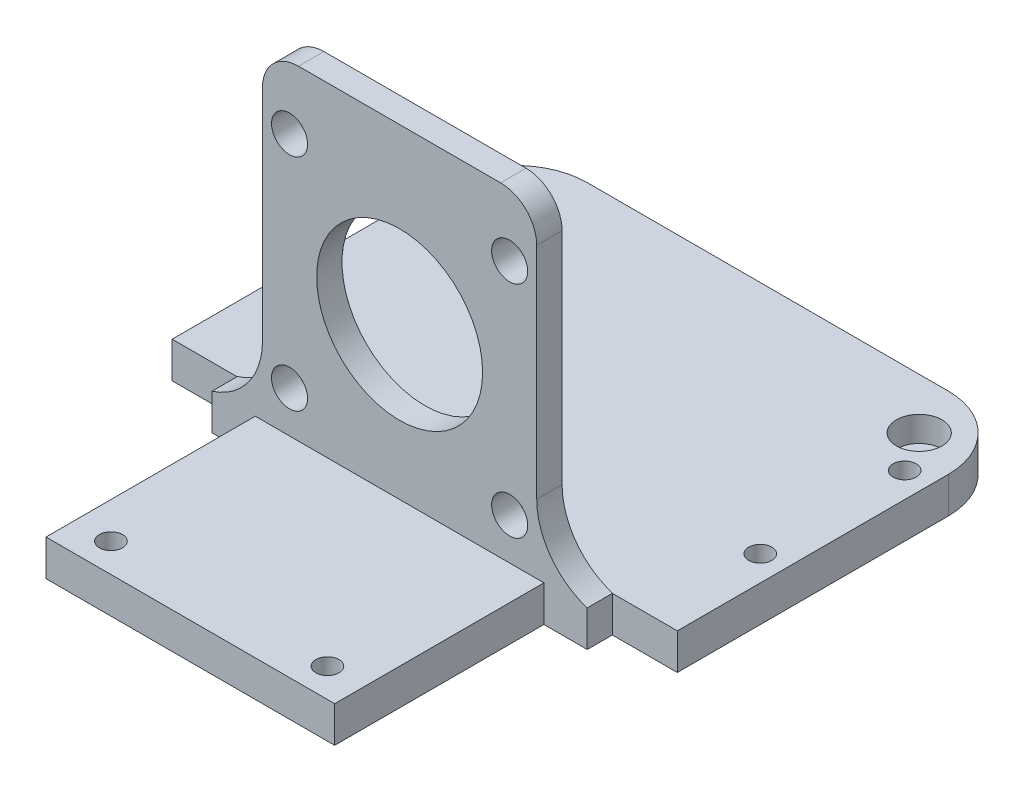
from build123d import *

# Parameters (mm, degrees)
SKETCH_1_W           = 70
SKETCH_1_H           = 5
EXTRUDE_1_DEPTH      = 8
SKETCH_3_W           = 38
SKETCH_3_H           = 5
EXTRUDE_2_DEPTH      = 43
SKETCH_4_W           = 38
SKETCH_4_H           = 5
EXTRUDE_3_DEPTH      = 45
SKETCH_5_R           = 11.5
SKETCH_5_R_2         = 1.6
CUT_EXTRUDE_2_DEPTH  = 45
FILLET_1_R           = 5
CUT_EXTRUDE_3_REACH  = 81.536
SKETCH_6_W           = 42
SKETCH_6_H           = 1.562526182
EXTRUDE_4_DEPTH      = 7
EXTRUDE_4_DEPTH_BACK = 45
SKETCH_7_W           = 13.004753842
SKETCH_7_H           = 5
FILLET_2_R           = 10
SKETCH_13_W          = 70
SKETCH_13_H          = 47.548344346
EXTRUDE_6_DEPTH      = 5
SKETCH_10_R          = 2.5
CUT_EXTRUDE_6_DEPTH  = 10
SKETCH_11_W          = 40
SKETCH_11_H          = 5
EXTRUDE_5_DEPTH      = 29
SKETCH_12_R          = 1.6
CUT_EXTRUDE_7_DEPTH  = 7
SKETCH_14_R          = 1.6
CUT_EXTRUDE_8_DEPTH  = 7
SKETCH_15_R          = 3.15
CUT_EXTRUDE_9_DEPTH  = 3.5
FILLET_3_R           = 10
SKETCH_16_R          = 1.6
CUT_EXTRUDE_10_DEPTH = 10


with BuildPart() as part:
    # 草图1 → 凸台-拉伸1 (new body)
    with BuildSketch(Plane.XY):
        Rectangle(SKETCH_1_W, SKETCH_1_H)
    extrude(amount=EXTRUDE_1_DEPTH)

    # 草图3 → 凸台-拉伸2 (add)
    with BuildSketch(Plane.XY.offset(8)):
        Rectangle(SKETCH_3_W, SKETCH_3_H)
    extrude(amount=EXTRUDE_2_DEPTH)

    # 草图4 → 凸台-拉伸3 (add)
    with BuildSketch(Plane(origin=(0, 2.5, 0), x_dir=(1, 0, 0), z_dir=(0, 1, 0))):
        with Locations((0, -48.5)):
            Rectangle(SKETCH_4_W, SKETCH_4_H)
    extrude(amount=EXTRUDE_3_DEPTH)

    # 草图5 → 切除-拉伸2 (cut)
    with BuildSketch(Plane.XY.offset(51)):
        with Locations((0, 23.5)):
            Circle(SKETCH_5_R)
        with Locations((-15.25, 38.75)):
            Circle(SKETCH_5_R_2)
        with Locations((15.25, 38.75)):
            Circle(SKETCH_5_R_2)
        with Locations((-15.25, 8.25)):
            Circle(SKETCH_5_R_2)
        with Locations((15.25, 8.25)):
            Circle(SKETCH_5_R_2)
    extrude(amount=-CUT_EXTRUDE_2_DEPTH, mode=Mode.SUBTRACT)

    # 圆角1
    fillet_1_edges = [part.edges().sort_by_distance(p)[0] for p in [
        (-19, 47.5, 48.5),
        (19, 47.5, 48.5),
    ]]
    fillet(fillet_1_edges, radius=FILLET_1_R)

    # 切除-拉伸3: up to this face of the body (flat: up to its plane)
    cut_extrude_3_end = Plane(part.part.faces().sort_by_distance((0, 2.5, 20.572854291))[0])
    # 草图6 → 切除-拉伸3 (cut, up to the picked face)
    with BuildSketch(Plane(origin=(0, 47.5, 0), x_dir=(1, 0, 0), z_dir=(0, 1, 0)), mode=Mode.PRIVATE) as cut_extrude_3_sk1:
        with Locations((0, -46.703490751)):
            Rectangle(SKETCH_6_W, SKETCH_6_H)
    cut_extrude_3_tool1 = split(extrude(cut_extrude_3_sk1.sketch, amount=-CUT_EXTRUDE_3_REACH, mode=Mode.PRIVATE), bisect_by=cut_extrude_3_end, keep=Keep.BOTH, mode=Mode.PRIVATE)
    add(cut_extrude_3_tool1.solids().sort_by(Axis((0, 47.5, 46.703491), (0, -1, 0)))[0], mode=Mode.SUBTRACT)

    # 草图7 → 凸台-拉伸4 (add, two sides: drawn at the far end of the back side and taken through both)
    with BuildSketch(Plane(origin=(19, 0, 0), x_dir=(0, 0, -1), z_dir=(1, 0, 0)).offset(-EXTRUDE_4_DEPTH_BACK)):
        with Locations((-44.497623079, 0)):
            Rectangle(SKETCH_7_W, SKETCH_7_H)
    extrude(amount=EXTRUDE_4_DEPTH + EXTRUDE_4_DEPTH_BACK)

    # 圆角2
    # the kernel refuses this fillet: 10 mm, written as the material it adds along each edge
    with BuildSketch(Plane(origin=(-19, 2.5, 47.484753842), x_dir=(-1, 0, 0), z_dir=(0, 0, 1)), Plane(origin=(19, 2.5, 51), x_dir=(1, 0, 0), z_dir=(0, 0, -1))) as fillet_2_piece_1:
        with BuildLine():
            CenterArc((10, -9.539392014), FILLET_2_R, 107.457603124, 72.542396876)
            Line((0, -9.539392014), (-0.2, -9.539392014))
            Line((-0.2, -9.539392014), (-0.2, 0))
            Line((-0.2, 0), (0, 0.2))
            ThreePointArc((0, 0.2), (3.5, 0.2), (6.94, 0.19078784))
            Line((6.94, 0.19078784), (7, 0))
        make_face()
    extrude(amount=3.515246158)

    # 草图13 → 凸台-拉伸6 (add)
    with BuildSketch(Plane(origin=(0, 2.5, 0), x_dir=(1, 0, 0), z_dir=(0, 1, 0))):
        with Locations((0, -23.742376921)):
            Rectangle(SKETCH_13_W, SKETCH_13_H)
    extrude(amount=-EXTRUDE_6_DEPTH)

    # 草图10 → 切除-拉伸6 (cut)
    with BuildSketch(Plane.XY.offset(51)):
        with Locations((-15.25, 38.75)):
            Circle(SKETCH_10_R)
        with Locations((15.25, 38.75)):
            Circle(SKETCH_10_R)
        with Locations((15.25, 8.25)):
            Circle(SKETCH_10_R)
        with Locations((-15.25, 8.25)):
            Circle(SKETCH_10_R)
    extrude(amount=-CUT_EXTRUDE_6_DEPTH, mode=Mode.SUBTRACT)

    # 草图11 → 凸台-拉伸5 (add)
    with BuildSketch(Plane.XY.offset(51)):
        Rectangle(SKETCH_11_W, SKETCH_11_H)
    extrude(amount=EXTRUDE_5_DEPTH)

    # 草图12 → 切除-拉伸7 (cut)
    with BuildSketch(Plane(origin=(0, 2.5, 0), x_dir=(1, 0, 0), z_dir=(0, 1, 0))):
        with Locations(Location((15, -76, 0), (0, 0, 180))):
            Circle(SKETCH_12_R)
        with Locations(Location((-15, -76, 0), (0, 0, 180))):
            Circle(SKETCH_12_R)
    extrude(amount=-CUT_EXTRUDE_7_DEPTH, mode=Mode.SUBTRACT)

    # 草图14 → 切除-拉伸8 (cut)
    with BuildSketch(Plane(origin=(0, 2.5, 0), x_dir=(1, 0, 0), z_dir=(0, 1, 0))):
        with Locations(Location((28, -7, 0), (0, 0, 270))):
            Circle(SKETCH_14_R)
        with Locations(Location((-28, -7, 0), (0, 0, 270))):
            Circle(SKETCH_14_R)
    extrude(amount=-CUT_EXTRUDE_8_DEPTH, mode=Mode.SUBTRACT)

    # 草图15 → 切除-拉伸9 (cut)
    with BuildSketch(Plane(origin=(0, 2.5, 0), x_dir=(1, 0, 0), z_dir=(0, 1, 0))):
        with Locations(Location((28, -7, 0), (0, 0, 270))):
            Circle(SKETCH_15_R)
        with Locations(Location((-28, -7, 0), (0, 0, 270))):
            Circle(SKETCH_15_R)
    extrude(amount=-CUT_EXTRUDE_9_DEPTH, mode=Mode.SUBTRACT)

    # 圆角3
    fillet_3_edges = [part.edges().sort_by_distance(p)[0] for p in [
        (35, 0, -0.031795252),
        (-35, 0, -0.031795252),
    ]]
    fillet(fillet_3_edges, radius=FILLET_3_R)

    # 草图16 → 切除-拉伸10 (cut)
    with BuildSketch(Plane(origin=(0, 2.5, 0), x_dir=(1, 0, 0), z_dir=(0, 1, 0))):
        with Locations(Location((31.5, -32.518590997, 0), (0, 0, 270))):
            Circle(SKETCH_16_R)
        with Locations(Location((31.5, -12.518590997, 0), (0, 0, 270))):
            Circle(SKETCH_16_R)
        with Locations(Location((-31.5, -32.518590997, 0), (0, 0, 270))):
            Circle(SKETCH_16_R)
        with Locations(Location((-31.5, -12.518590997, 0), (0, 0, 270))):
            Circle(SKETCH_16_R)
    extrude(amount=-CUT_EXTRUDE_10_DEPTH, mode=Mode.SUBTRACT)


solid = part.part
